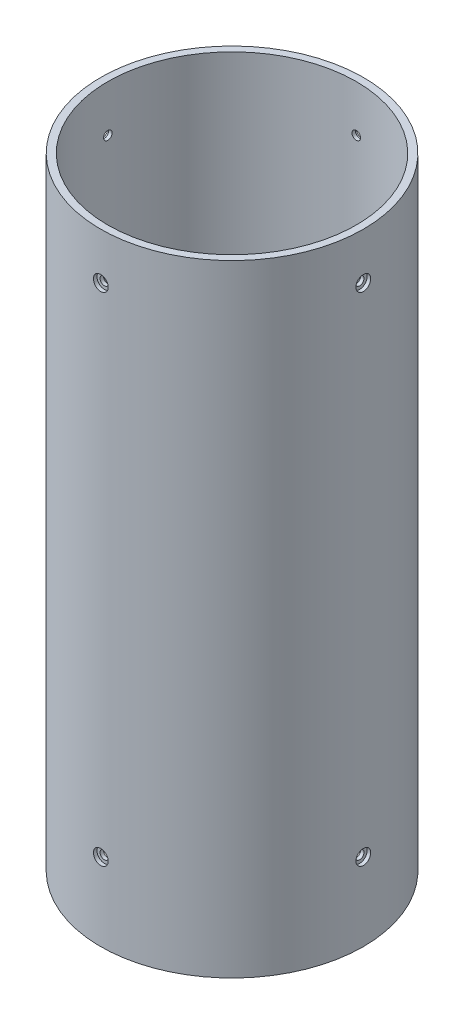
from build123d import *

# Parameters (mm, degrees)
SKETCH1_R                         = 53.721
SKETCH1_R_2                       = 50.8
BODY_EXTRUSION_DEPTH              = 254
UPPER_BULKHEAD_HOLES_REACH        = 282.973
SKETCH2_R                         = 1.7526
UPPER_BULKHEAD_HOLE_PATTERN_COUNT = 4
LOWER_BULKHEAD_HOLES_REACH        = 282.973
SKETCH3_R                         = 1.7526
LOWER_BULKHEAD_HOLE_PATTERN_COUNT = 4
SKETCH4_R                         = 3.0226
COUNTERSINK_DEPTH                 = 1.524
COUNTERSINK_PATTERN_COUNT         = 4


with BuildPart() as part:
    # Sketch1 → Body Extrusion (new body)
    with BuildSketch(Plane(origin=(0, 0, 0), x_dir=(1, 0, 0), z_dir=(0, 1, 0))):
        Circle(SKETCH1_R)
        Circle(SKETCH1_R_2, mode=Mode.SUBTRACT)
    extrude(amount=BODY_EXTRUSION_DEPTH)

    # Sketch2 → Upper Bulkhead Holes (cut, up to next)
    with BuildSketch(Plane.XY.offset(53.721), mode=Mode.PRIVATE) as upper_bulkhead_holes_sk1:
        with Locations((0, 234.95)):
            Circle(SKETCH2_R)
    upper_bulkhead_holes_tool1 = extrude(upper_bulkhead_holes_sk1.sketch, amount=-UPPER_BULKHEAD_HOLES_REACH, mode=Mode.PRIVATE) & part.part
    upper_bulkhead_holes = upper_bulkhead_holes_tool1.solids().sort_by_distance((0, 234.95, 53.721))[0]
    add(upper_bulkhead_holes, mode=Mode.SUBTRACT)

    # Upper Bulkhead Hole Pattern: Upper Bulkhead Holes ×4 about axis
    upper_bulkhead_hole_pattern_axis = Axis((0, 254, 0), (0, -1, 0))
    for i in range(1, UPPER_BULKHEAD_HOLE_PATTERN_COUNT):
        add(upper_bulkhead_holes.rotate(upper_bulkhead_hole_pattern_axis, i * 360 / UPPER_BULKHEAD_HOLE_PATTERN_COUNT), mode=Mode.SUBTRACT)

    # Sketch3 → Lower Bulkhead Holes (cut, up to next)
    with BuildSketch(Plane.XY.offset(53.721), mode=Mode.PRIVATE) as lower_bulkhead_holes_sk1:
        with Locations((0, 31.75)):
            Circle(SKETCH3_R)
    lower_bulkhead_holes_tool1 = extrude(lower_bulkhead_holes_sk1.sketch, amount=-LOWER_BULKHEAD_HOLES_REACH, mode=Mode.PRIVATE) & part.part
    lower_bulkhead_holes = lower_bulkhead_holes_tool1.solids().sort_by_distance((0, 31.75, 53.721))[0]
    add(lower_bulkhead_holes, mode=Mode.SUBTRACT)

    # Lower Bulkhead Hole Pattern: Lower Bulkhead Holes ×4 about axis
    lower_bulkhead_hole_pattern_axis = Axis((0, 254, 0), (0, -1, 0))
    for i in range(1, LOWER_BULKHEAD_HOLE_PATTERN_COUNT):
        add(lower_bulkhead_holes.rotate(lower_bulkhead_hole_pattern_axis, i * 360 / LOWER_BULKHEAD_HOLE_PATTERN_COUNT), mode=Mode.SUBTRACT)

    # Sketch4 → Countersink (cut)
    with BuildSketch(Plane.XY.offset(53.721)):
        with Locations((0, 234.95)):
            Circle(SKETCH4_R)
        with Locations((0, 31.75)):
            Circle(SKETCH4_R)
    countersink = extrude(amount=-COUNTERSINK_DEPTH, mode=Mode.SUBTRACT)

    # Countersink Pattern: Countersink ×4 about axis
    countersink_pattern_axis = Axis((0, 254, 0), (0, -1, 0))
    for i in range(1, COUNTERSINK_PATTERN_COUNT):
        add(countersink.rotate(countersink_pattern_axis, i * 360 / COUNTERSINK_PATTERN_COUNT), mode=Mode.SUBTRACT)


solid = part.part
